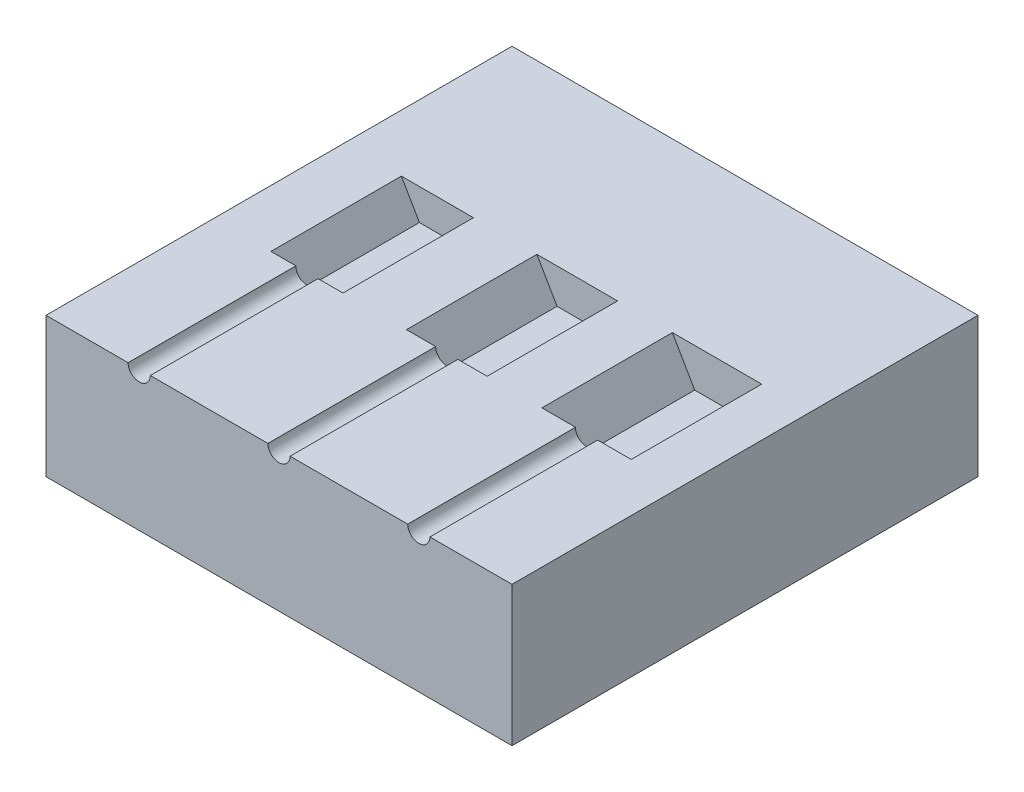
from build123d import *

# Parameters (mm, degrees)
SKETCH2_W            = 25
SKETCH2_H            = 25
BOSS_EXTRUDE1_DEPTH  = 7.5
CUT_HEX_DEPTH        = 3.5
CUT_HEX_DEPTH_BACK   = 3.5
SKETCH4_R            = 0.5955
CUT_CABLE_EXIT_DEPTH = 31.61453903


with BuildPart() as part:
    # Sketch2 → Boss-Extrude1 (new body)
    with BuildSketch(Plane(origin=(0, 0, 0), x_dir=(1, 0, 0), z_dir=(0, 1, 0))):
        with Locations((12.5, 12.5)):
            Rectangle(SKETCH2_W, SKETCH2_H)
    extrude(amount=BOSS_EXTRUDE1_DEPTH)

    # Sketch3 → Cut-Hex (cut, two sides: drawn at the far end of the back side and taken through both)
    with BuildSketch(Plane.XY.offset(-12.5).offset(-CUT_HEX_DEPTH_BACK)):
        Polygon((4.032938299, 5.825), (5.967061701, 5.825), (6.934123402, 7.5), (3.065876598, 7.5), align=None)
        Polygon((11.417468245, 5.625), (13.582531755, 5.625), (14.665063509, 7.5), (10.334936491, 7.5), align=None)
        Polygon((18.801998191, 5.425), (21.198001809, 5.425), (22.396003617, 7.5), (17.603996383, 7.5), align=None)
    extrude(amount=CUT_HEX_DEPTH + CUT_HEX_DEPTH_BACK, mode=Mode.SUBTRACT)

    # Sketch4 → Cut-Cable Exit (cut, through all)
    with BuildSketch(Plane(origin=(0, 0, -9), x_dir=(-1, 0, 0), z_dir=(0, 0, -1))):
        with Locations((-12.5, 7.5)):
            Circle(SKETCH4_R)
        with Locations((-20, 7.5)):
            Circle(SKETCH4_R)
        with Locations((-5, 7.5)):
            Circle(SKETCH4_R)
    extrude(amount=-CUT_CABLE_EXIT_DEPTH, mode=Mode.SUBTRACT)


solid = part.part
